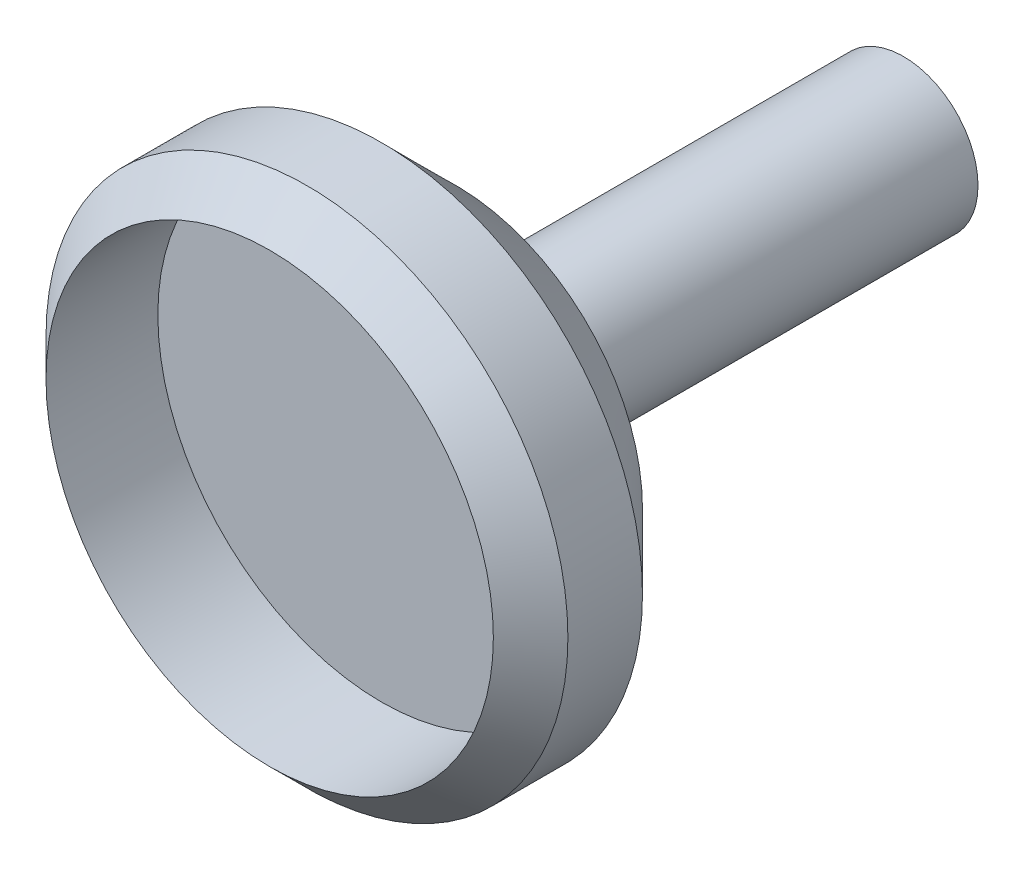
from build123d import *

# Parameters (mm, degrees)
ESBO_O1_R                = 1
ESBO_O1_R_2              = 0.5
RESSALTO_EXTRUS_O1_DEPTH = 6
ESBO_O3_R                = 3.5
RESSALTO_EXTRUS_O2_DEPTH = 3
ESBO_O4_R                = 3
CORTE_EXTRUS_O1_DEPTH    = 2
CHANFRO1_SIZE            = 1


with BuildPart() as part:
    # Esboço1 → Ressalto-extrusão1 (new body)
    with BuildSketch(Plane.XY):
        Circle(ESBO_O1_R)
        Circle(ESBO_O1_R_2, mode=Mode.SUBTRACT)
    extrude(amount=RESSALTO_EXTRUS_O1_DEPTH)

    # Esboço3 → Ressalto-extrusão2 (add)
    with BuildSketch(Plane.XY.offset(6)):
        Circle(ESBO_O3_R)
    extrude(amount=RESSALTO_EXTRUS_O2_DEPTH)

    # Esboço4 → Corte-extrusão1 (cut)
    with BuildSketch(Plane.XY.offset(9)):
        Circle(ESBO_O4_R)
    extrude(amount=-CORTE_EXTRUS_O1_DEPTH, mode=Mode.SUBTRACT)

    # Chanfro1
    # the kernel refuses this chamfer: 1 mm, written as the material it takes off along each edge
    with BuildSketch(Plane(origin=(0, 0, 9), x_dir=(1, 0, 0), z_dir=(0, -1, 0))) as chanfro1_piece_1:
        Polygon((3.5, -CHANFRO1_SIZE), (3.5 - CHANFRO1_SIZE, 0), (3.5, 0), align=None)
    revolve(axis=Axis((0, 0, 9), (0, 0, 1)), mode=Mode.SUBTRACT)
    with BuildSketch(Plane(origin=(0, 0, 6), x_dir=(1, 0, 0), z_dir=(0, -1, 0))) as chanfro1_piece_2:
        Polygon((3.5, CHANFRO1_SIZE), (3.5 - CHANFRO1_SIZE, 0), (3.5, 0), align=None)
    revolve(axis=Axis((0, 0, 6), (0, 0, 1)), mode=Mode.SUBTRACT)


solid = part.part
